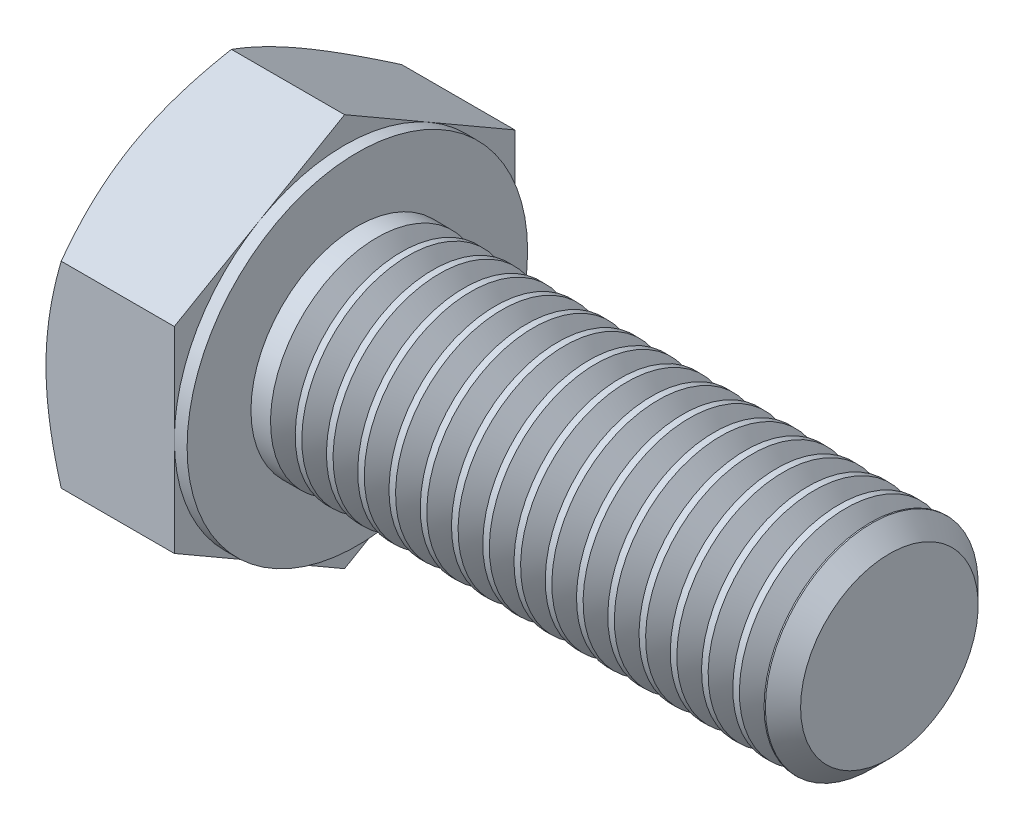
from build123d import *

# Parameters (mm, degrees)
BASEHEAD_DEPTH     = 6.63
INDENT_START       = -0.82875
INDENT_2_OUTLINE_R = 7
INDENT_2_DEPTH     = 0.82875
SKETCH4_W          = 0.6
SKETCH4_H          = 11.237604307
THDSCHPAT_COUNT    = 16
THDSCHPAT_PITCH    = 1.46875


# Read off the part's stored shape, not the designer's step: Indent
with BuildPart() as part:
    # Sketch1 → BaseHead (new body)
    with BuildSketch(Plane(origin=(0, 0, 0), x_dir=(0, 0, -1), z_dir=(1, 0, 0))):
        Polygon((8, 4.618802154), (8, -4.618802154), (0, -9.237604307), (-8, -4.618802154), (-8, 4.618802154), (0, 9.237604307), align=None)
    extrude(amount=BASEHEAD_DEPTH)

    # Indent outline → Indent (revolve)
    with BuildSketch(Plane.YX):
        Polygon((5, 6.63), (5, 30.802), (4.172, 31.63), (0, 31.63), (0, 6.63), align=None)
    revolve(axis=Axis((0, 0, 0), (1, 0, 0)))

    # Indent 2 outline → Indent 2 (cut)
    with BuildSketch(Plane.ZY.offset(INDENT_START)):
        with Locations((0.033212245, 0.192376607)):
            Circle(INDENT_2_OUTLINE_R)
    extrude(amount=INDENT_2_DEPTH, mode=Mode.SUBTRACT)

    # Sketch3 → HeadChamfer (revolve, cut)
    with BuildSketch(Plane.XY, mode=Mode.PRIVATE) as headchamfer_sk:
        Polygon((0, 8), (3.601282526, 14.237604307), (3.601282526, 19.237604307), (-10, 19.237604307), (-10, 8), align=None)
    revolve(headchamfer_sk.sketch.rotate(Axis((0, 0, 0), (1, 0, 0)), 90), axis=Axis((0, 0, 0), (1, 0, 0)), mode=Mode.SUBTRACT)

    # Sketch4 → BearingFace (revolve, cut)
    with BuildSketch(Plane.XY, mode=Mode.PRIVATE) as bearingface_sk:
        with Locations((6.33, 13.618802154)):
            Rectangle(SKETCH4_W, SKETCH4_H)
    revolve(bearingface_sk.sketch.rotate(Axis((0, 0, 0), (1, 0, 0)), 90), axis=Axis((0, 0, 0), (1, 0, 0)), mode=Mode.SUBTRACT)

    # ThdSchSke → ThreadSchematic (revolve, cut)
    with BuildSketch(Plane.XY):
        Polygon((8.13, -4.172), (7.550228158, -5), (7.550228158, -6.25), (8.709771842, -6.25), (8.709771842, -5), align=None)
    threadschematic = revolve(axis=Axis((-3.175, 0, 0), (1, 0, 0)), mode=Mode.SUBTRACT)

    # ThdSchPat: ThreadSchematic ×16
    with Locations(*[(i * THDSCHPAT_PITCH, 0, 0) for i in range(1, THDSCHPAT_COUNT)]):
        add(threadschematic, mode=Mode.SUBTRACT)


solid = part.part
